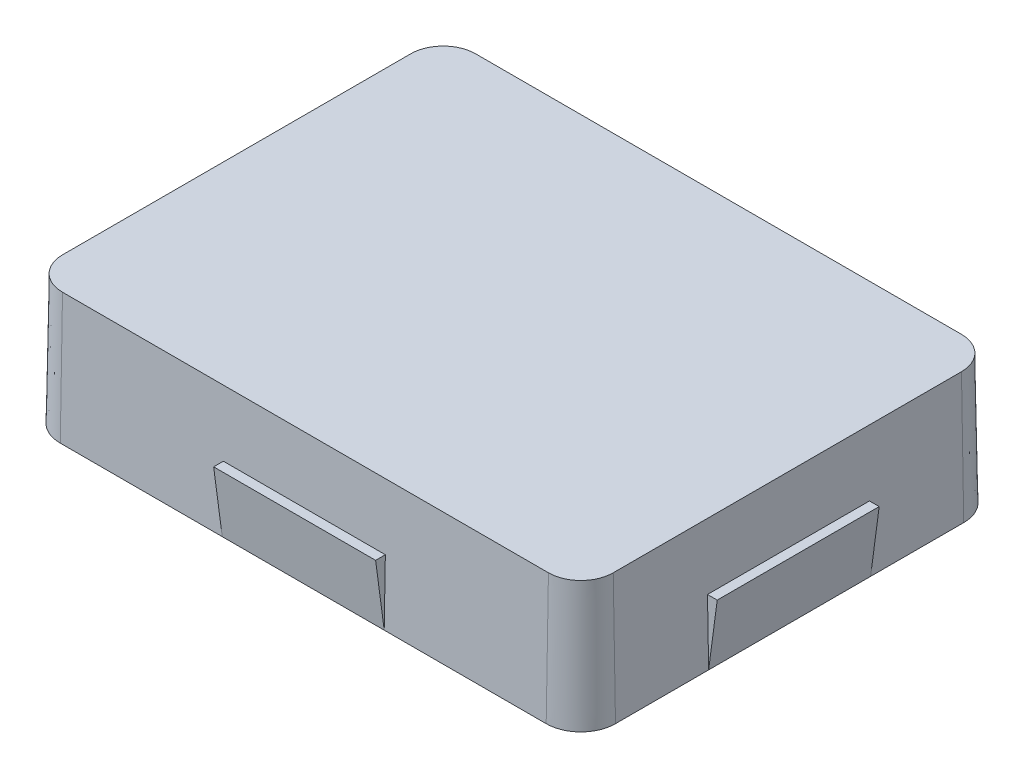
from build123d import *

# Parameters (mm, degrees)
BOSS_EXTRUDE1_DEPTH = 4
BOSS_EXTRUDE1_DRAFT = 1
SHELL1_T            = -0.5
SKETCH2_R           = 2
BOSS_EXTRUDE2_DEPTH = 5.5
BOSS_EXTRUDE2_TAPER = 1.5
CIRPATTERN1_COUNT   = 4
SKETCH4_R           = 1.605977431
CUT_EXTRUDE1_DEPTH  = 5.5
CUT_EXTRUDE1_DRAFT  = 1.5
BOSS_EXTRUDE3_DEPTH = 2.5
BOSS_EXTRUDE4_DEPTH = 2.5


with BuildPart() as part:
    # Sketch1 → Boss-Extrude1 (with draft: the straight prism first)
    with BuildSketch(Plane(origin=(0, 0, 0), x_dir=(1, 0, 0), z_dir=(0, 1, 0))):
        with BuildLine():
            Line((-7.5, -6.375), (7.5, -6.375))
            ThreePointArc((7.5, -6.375), (8.207106781, -6.082106781), (8.5, -5.375))
            Line((8.5, -5.375), (8.5, 5.375))
            ThreePointArc((8.5, 5.375), (8.207106781, 6.082106781), (7.5, 6.375))
            Line((7.5, 6.375), (-7.5, 6.375))
            ThreePointArc((-7.5, 6.375), (-8.207106781, 6.082106781), (-8.5, 5.375))
            Line((-8.5, 5.375), (-8.5, -5.375))
            ThreePointArc((-8.5, -5.375), (-8.207106781, -6.082106781), (-7.5, -6.375))
        make_face()
    extrude(amount=-BOSS_EXTRUDE1_DEPTH)
    # Boss-Extrude1: the draft: its side faces are tilted about the plane it starts from
    boss_extrude1_sides = [part.faces().sort_by_distance(p)[0] for p in [
        (0, -2, 6.375),
        (8.207106781, -2, 6.082106781),
        (8.5, -2, 0),
        (8.207106781, -2, -6.082106781),
        (0, -2, -6.375),
        (-8.207106781, -2, -6.082106781),
        (-8.5, -2, 0),
        (-8.207106781, -2, 6.082106781),
    ]]
    draft(boss_extrude1_sides, Plane(origin=(0, 0, 0), x_dir=(1, 0, 0), z_dir=(0, 1, 0)), BOSS_EXTRUDE1_DRAFT)

    # Shell1
    shell1_openings = [part.faces().sort_by_distance(p)[0] for p in [
        (0, -4, 0),
    ]]
    offset(amount=SHELL1_T, openings=shell1_openings, kind=Kind.INTERSECTION)

    # Sketch2 → Boss-Extrude2 (add)
    with BuildSketch(Plane.XZ.offset(0.5)):
        Circle(SKETCH2_R)
    extrude(amount=BOSS_EXTRUDE2_DEPTH, taper=BOSS_EXTRUDE2_TAPER)

    # Rib1: read off the stored shape, not the designer's step
    # Rib1: loft between two sections, ruled curve by curve
    rib1_from = [
        Edge.make_line((1.98200852, -0.5, 0.267660658), (3, -0.5, 0.25)),
        Edge.make_line((1.98200852, -0.5, -0.267660658), (3, -0.5, -0.25)),
        Edge.make_line((3, -0.5, -0.25), (3, -0.5, 0.25)),
        Edge.make_line((1.98200852, -0.5, -0.267660658), (1.98200852, -0.5, 0.267660658)),
    ]
    rib1_to = [
        Edge.make_line((1.837736121, -6, 0.25957306), (2.389544218, -6, 0.25)),
        Edge.make_line((1.837736121, -6, -0.25957306), (2.389544218, -6, -0.25)),
        Edge.make_line((2.389544218, -6, -0.25), (2.389544218, -6, 0.25)),
        Edge.make_line((1.837736121, -6, -0.25957306), (1.837736121, -6, 0.25957306)),
    ]
    rib1 = Solid(Shell([*[Face.make_surface_from_curves(rib1_from[k], rib1_to[k]) for k in range(4)], Face(Wire(rib1_from)), Face(Wire(rib1_to))]))
    add(rib1)

    # CirPattern1: Rib1 ×4 about axis
    cirpattern1_axis = Axis((0, 0, 0), (0, 1, 0))
    for i in range(1, CIRPATTERN1_COUNT):
        add(rib1.rotate(cirpattern1_axis, i * 360 / CIRPATTERN1_COUNT))


with BuildPart() as cut_extrude1_tool:
    # Sketch4 → Cut-Extrude1 (with draft: the straight prism first)
    with BuildSketch(Plane.XZ.offset(6)):
        Circle(SKETCH4_R)
    extrude(amount=-CUT_EXTRUDE1_DEPTH)
    # Cut-Extrude1: the draft: its side faces are tilted about the plane it starts from
    cut_extrude1_sides = [cut_extrude1_tool.faces().sort_by_distance(p)[0] for p in [
        (-1.605977431, -3.25, 0),
    ]]
    draft(cut_extrude1_sides, Plane.XZ.offset(6), CUT_EXTRUDE1_DRAFT)


with BuildPart() as part_1:
    add(part.part)

    # Cut-Extrude1: cut by cut_extrude1_tool
    add(cut_extrude1_tool.part, mode=Mode.SUBTRACT)

    # Sketch5 → Boss-Extrude3 (add, symmetric)
    with BuildSketch(Plane(origin=(0, 0, 0), x_dir=(0, 0, -1), z_dir=(1, 0, 0))):
        Polygon((6.44482026, -4), (6.40991013, -2), (6.70991013, -2), align=None)
        Polygon((-6.70991013, -2), (-6.44482026, -4), (-6.40991013, -2), align=None)
    extrude(amount=BOSS_EXTRUDE3_DEPTH, both=True)

    # Sketch6 → Boss-Extrude4 (add, symmetric)
    with BuildSketch(Plane.XY):
        Polygon((8.56982026, -4), (8.53491013, -2), (8.83491013, -2), align=None)
        Polygon((-8.83491013, -2), (-8.56982026, -4), (-8.53491013, -2), align=None)
    extrude(amount=BOSS_EXTRUDE4_DEPTH, both=True)


solid = part_1.part
